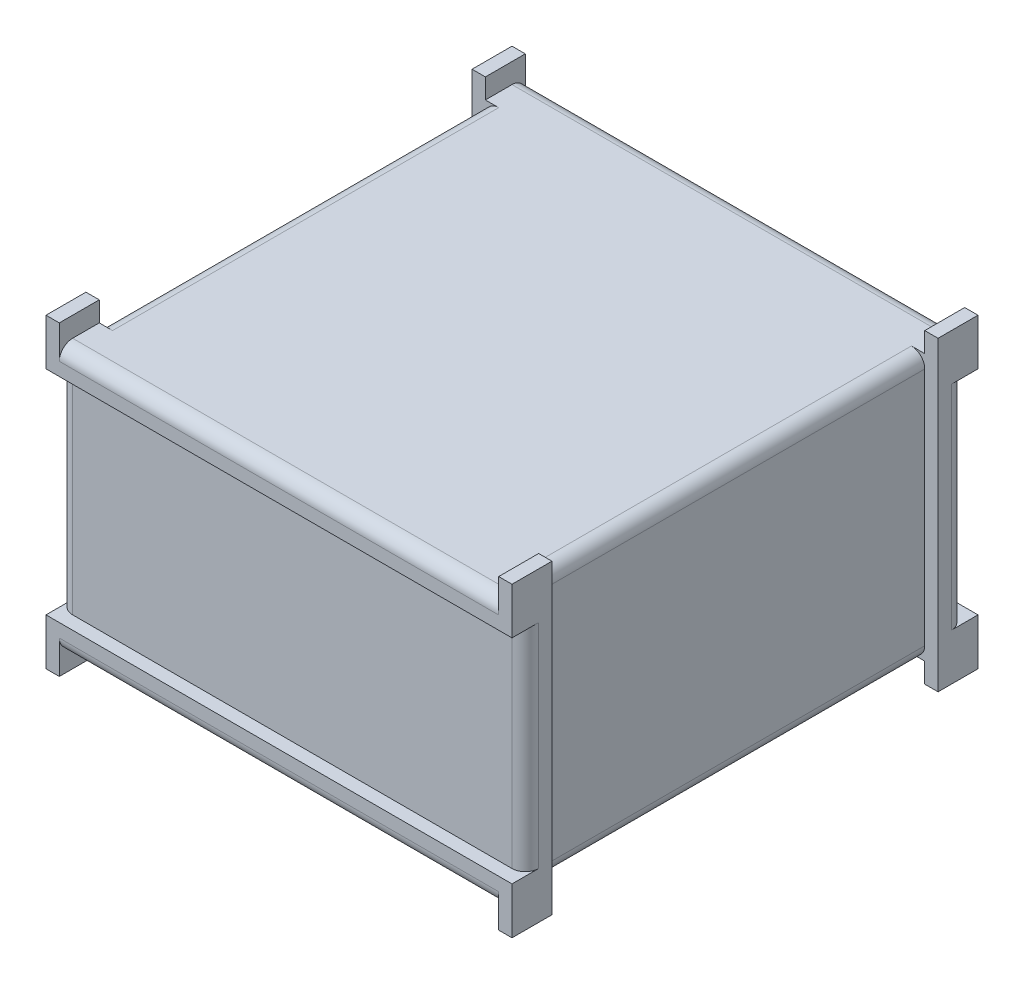
from build123d import *

# Parameters (mm, degrees)
BOSS_EXTRUDE1_DEPTH = 23
CUT_EXTRUDE1_DEPTH  = 1.5
CUT_EXTRUDE2_DEPTH  = 1.5
FILLET2_R           = 1
FILLET3_R           = 1
FILLET4_R           = 1
FILLET5_R           = 1
CUT_EXTRUDE3_DEPTH  = 1
FILLET6_R           = 1
FILLET7_R           = 1
SKETCH6_W           = 35
SKETCH6_H           = 16.000000000000004
CUT_EXTRUDE4_DEPTH  = 1
FILLET8_R           = 1
FILLET9_R           = 1
CUT_EXTRUDE5_DEPTH  = 1
CUT_EXTRUDE6_DEPTH  = 1
FILLET10_R          = 1
FILLET11_R          = 1
FILLET12_R          = 1
FILLET13_R          = 1


with BuildPart() as part:
    # Sketch1 → Boss-Extrude1 (new body)
    with BuildSketch(Plane(origin=(0, 0, 0), x_dir=(1, 0, 0), z_dir=(0, 1, 0))):
        Polygon((-13.200362647325472, 10.07479601087942), (21.799637352674534, 10.07479601087942), (21.799637352674537, -24.925203989120583), (-13.200362647325466, -24.925203989120583), align=None)
    extrude(amount=BOSS_EXTRUDE1_DEPTH)

    # Sketch2 → Cut-Extrude1 (cut)
    with BuildSketch(Plane(origin=(0, 23, 0), x_dir=(1, 0, 0), z_dir=(0, 1, 0))):
        Polygon((20.79963735267453, -24.925203989120583), (-12.200362647325468, -24.925203989120586), (-12.20036264732547, 10.074796010879416), (20.79963735267453, 10.07479601087942), align=None)
    extrude(amount=-CUT_EXTRUDE1_DEPTH, mode=Mode.SUBTRACT)

    # Sketch3 → Cut-Extrude2 (cut)
    with BuildSketch(Plane.XZ):
        Polygon((20.799637352674537, -10.07479601087942), (-12.200362647325464, -10.074796010879423), (-12.200362647325463, 24.92520398912058), (20.799637352674537, 24.925203989120583), align=None)
    extrude(amount=-CUT_EXTRUDE2_DEPTH, mode=Mode.SUBTRACT)

    # Fillet2
    fillet2_edges = [part.edges().sort_by_distance(p)[0] for p in [
        (4.29963735267453, 21.5, -10.074796010879417),
    ]]
    fillet(fillet2_edges, radius=FILLET2_R)

    # Fillet3
    fillet3_edges = [part.edges().sort_by_distance(p)[0] for p in [
        (4.29963735267453, 21.5, 24.925203989120583),
    ]]
    fillet(fillet3_edges, radius=FILLET3_R)

    # Fillet4
    fillet4_edges = [part.edges().sort_by_distance(p)[0] for p in [
        (4.299637352674537, 1.5, 24.925203989120583),
    ]]
    fillet(fillet4_edges, radius=FILLET4_R)

    # Fillet5
    fillet5_edges = [part.edges().sort_by_distance(p)[0] for p in [
        (4.299637352674537, 1.5, -10.074796010879421),
    ]]
    fillet(fillet5_edges, radius=FILLET5_R)

    # Sketch5 → Cut-Extrude3 (cut)
    with BuildSketch(Plane(origin=(0, 0, -10.07479601087942), x_dir=(-1, 0, 0), z_dir=(0, 0, -1))):
        Polygon((13.200362647325472, 3.5089999999999977), (-21.799637352674534, 3.5089999999999937), (-21.799637352674534, 19.508999999999997), (13.200362647325472, 19.509), align=None)
    extrude(amount=-CUT_EXTRUDE3_DEPTH, mode=Mode.SUBTRACT)

    # Fillet6
    fillet6_edges = [part.edges().sort_by_distance(p)[0] for p in [
        (-13.200362647325472, 11.508999999999999, -9.07479601087942),
    ]]
    fillet(fillet6_edges, radius=FILLET6_R)

    # Fillet7
    fillet7_edges = [part.edges().sort_by_distance(p)[0] for p in [
        (21.799637352674534, 11.508999999999995, -9.07479601087942),
    ]]
    fillet(fillet7_edges, radius=FILLET7_R)

    # Sketch6 → Cut-Extrude4 (cut)
    with BuildSketch(Plane.XY.offset(24.925203989120583)):
        with Locations((4.299637352674536, 11.508999999999999)):
            Rectangle(SKETCH6_W, SKETCH6_H)
    extrude(amount=-CUT_EXTRUDE4_DEPTH, mode=Mode.SUBTRACT)

    # Fillet8
    fillet8_edges = [part.edges().sort_by_distance(p)[0] for p in [
        (-13.200362647325463, 11.509, 23.925203989120583),
    ]]
    fillet(fillet8_edges, radius=FILLET8_R)

    # Fillet9
    fillet9_edges = [part.edges().sort_by_distance(p)[0] for p in [
        (21.799637352674537, 11.508999999999999, 23.925203989120583),
    ]]
    fillet(fillet9_edges, radius=FILLET9_R)

    # Sketch7 → Cut-Extrude5 (cut)
    with BuildSketch(Plane(origin=(21.799637352674537, 0, -4.32e-15), x_dir=(-2e-16, 0, -1), z_dir=(1, 0, -2e-16))):
        Polygon((7.074796010879417, -1.2e-16), (-21.925203989120586, -3.95e-15), (-21.925203989120586, 22.999999999999996), (7.074796010879417, 22.999999999999996), align=None)
    extrude(amount=-CUT_EXTRUDE5_DEPTH, mode=Mode.SUBTRACT)

    # Sketch8 → Cut-Extrude6 (cut)
    with BuildSketch(Plane(origin=(-13.200362647325473, 0, -13.200362647325468), x_dir=(-1.5e-16, 0, -1), z_dir=(1, 0, -1.5e-16))):
        Polygon((-6.125566636446044, 8e-17), (-35.125566636446045, -3.47e-15), (-35.125566636446045, 22.999999999999996), (-6.1255666364460435, 23), align=None)
    extrude(amount=CUT_EXTRUDE6_DEPTH, mode=Mode.SUBTRACT)

    # Fillet10
    fillet10_edges = [part.edges().sort_by_distance(p)[0] for p in [
        (-12.20036264732547, 21.5, 7.425203989120572),
    ]]
    fillet(fillet10_edges, radius=FILLET10_R)

    # Fillet11
    fillet11_edges = [part.edges().sort_by_distance(p)[0] for p in [
        (-12.200362647325463, 1.5, 7.425203989120577),
    ]]
    fillet(fillet11_edges, radius=FILLET11_R)

    # Fillet12
    # the kernel refuses this fillet: 1 mm, written as the material it takes off along each edge
    with BuildSketch(Plane(origin=(20.79963735267453, 21.5, -7.074796010879421), x_dir=(-1, 0, 0), z_dir=(0, 0, 1))) as fillet12_piece_1:
        with BuildLine():
            CenterArc((FILLET12_R, FILLET12_R), FILLET12_R, 180, 90)
            Line((0, FILLET12_R), (0, 0))
            Line((0, 0), (FILLET12_R, 0))
        make_face()
    extrude(amount=29.000000000000004, mode=Mode.SUBTRACT)

    # Fillet13
    # the kernel refuses this fillet: 1 mm, written as the material it takes off along each edge
    with BuildSketch(Plane(origin=(20.799637352674537, 1.5, 21.925203989120583), x_dir=(-1, 0, 0), z_dir=(0, 0, -1))) as fillet13_piece_1:
        with BuildLine():
            CenterArc((FILLET13_R, FILLET13_R), FILLET13_R, 180, 90)
            Line((0, FILLET13_R), (0, 0))
            Line((0, 0), (FILLET13_R, 0))
        make_face()
    extrude(amount=29, mode=Mode.SUBTRACT)


solid = part.part
